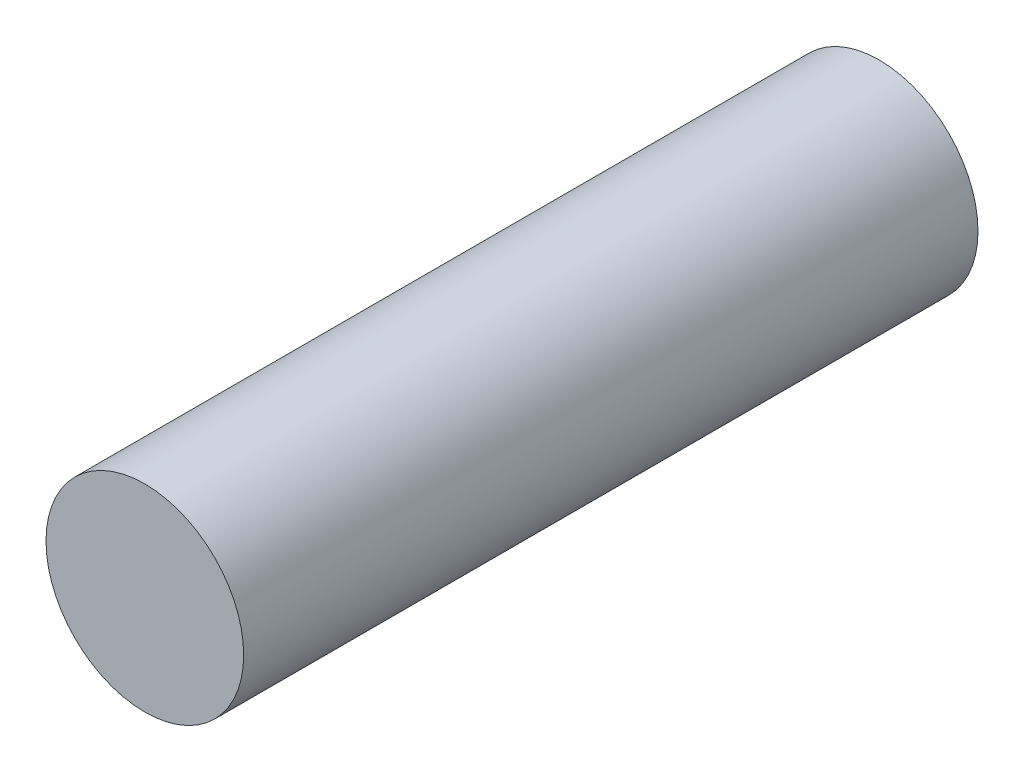
from build123d import *

# Parameters (mm, degrees)
SKETCH1_R           = 2.49
BOSS_EXTRUDE1_DEPTH = 9.25


with BuildPart() as part:
    # Sketch1 → Boss-Extrude1 (new, symmetric)
    with BuildSketch(Plane.XY):
        Circle(SKETCH1_R)
    extrude(amount=BOSS_EXTRUDE1_DEPTH, both=True)


solid = part.part
